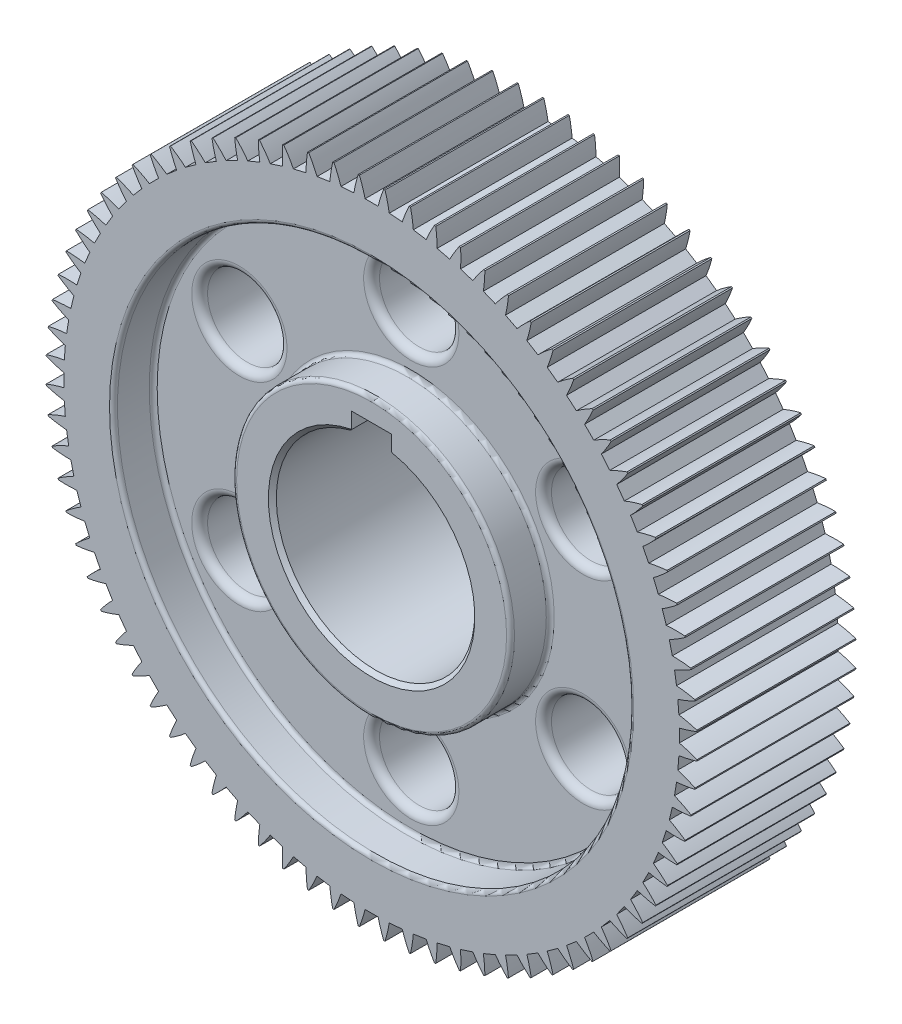
from build123d import *

# Parameters (mm, degrees)
SKETCH1_R           = 82
BOSS_EXTRUDE1_DEPTH = 40
CUT_EXTRUDE1_DEPTH  = 123.670289802
CIRPATTERN1_COUNT   = 80
CUT_EXTRUDE2_DEPTH  = 123.593963799
SKETCH5_R           = 65
SKETCH5_R_2         = 35
CUT_EXTRUDE3_DEPTH  = 10
CUT_EXTRUDE5_START  = -30
SKETCH5_3_R         = 65
SKETCH5_3_R_2       = 35
CUT_EXTRUDE5_DEPTH  = 10
SKETCH6_R           = 10
CUT_EXTRUDE6_DEPTH  = 120.704970489
CIRPATTERN2_COUNT   = 6
CHAMFER1_SIZE       = 1.282386845
CHAMFER1_SIZE_2     = 1
FILLET1_R           = 1
FILLET2_R           = 1
FILLET3_R           = 2


with BuildPart() as part:
    # Sketch1 → Boss-Extrude1 (new body)
    with BuildSketch(Plane.XY):
        Circle(SKETCH1_R)
    extrude(amount=BOSS_EXTRUDE1_DEPTH)

    # Sketch3 → Cut-Extrude1 (cut, through all)
    with BuildSketch(Plane.XY.offset(40)):
        with BuildLine():
            Line((3.082235405, 82), (-3.082235405, 82))
            ThreePointArc((-3.082235405, 82), (-2.280035939, 79.775379357), (-1.63574581, 77.5))
            Line((-1.63574581, 77.5), (1.63574581, 77.5))
            ThreePointArc((1.63574581, 77.5), (2.280035939, 79.775379357), (3.082235405, 82))
        make_face()
    cut_extrude1 = extrude(amount=-CUT_EXTRUDE1_DEPTH, mode=Mode.SUBTRACT)

    # CirPattern1: Cut-Extrude1 ×80 about axis
    cirpattern1_axis = Axis((0, 0, 0), (0, 0, 1))
    for i in range(1, CIRPATTERN1_COUNT):
        add(cut_extrude1.rotate(cirpattern1_axis, i * 360 / CIRPATTERN1_COUNT), mode=Mode.SUBTRACT)

    # Sketch4 → Cut-Extrude2 (cut, through all)
    with BuildSketch(Plane.XY.offset(40)):
        with BuildLine():
            Line((-5, 24.494897428), (-5, 29.494897428))
            Line((-5, 29.494897428), (5, 29.494897428))
            Line((5, 29.494897428), (5, 24.494897428))
            ThreePointArc((5, 24.494897428), (0, -25), (-5, 24.494897428))
        make_face()
    extrude(amount=-CUT_EXTRUDE2_DEPTH, mode=Mode.SUBTRACT)

    # Sketch5 → Cut-Extrude3 (cut)
    with BuildSketch(Plane.XY.offset(40)):
        Circle(SKETCH5_R)
        Circle(SKETCH5_R_2, mode=Mode.SUBTRACT)
    extrude(amount=-CUT_EXTRUDE3_DEPTH, mode=Mode.SUBTRACT)

    # Sketch5<3> → Cut-Extrude5 (cut)
    with BuildSketch(Plane.XY.offset(40).offset(CUT_EXTRUDE5_START)):
        Circle(SKETCH5_3_R)
        Circle(SKETCH5_3_R_2, mode=Mode.SUBTRACT)
    extrude(amount=-CUT_EXTRUDE5_DEPTH, mode=Mode.SUBTRACT)

    # Sketch6 → Cut-Extrude6 (cut, through all)
    with BuildSketch(Plane.XY.offset(30)):
        with Locations((0, 50)):
            Circle(SKETCH6_R)
    cut_extrude6 = extrude(amount=-CUT_EXTRUDE6_DEPTH, mode=Mode.SUBTRACT)

    # CirPattern2: Cut-Extrude6 ×6 about axis
    cirpattern2_axis = Axis((0, 0, 0), (0, 0, 1))
    for i in range(1, CIRPATTERN2_COUNT):
        add(cut_extrude6.rotate(cirpattern2_axis, i * 360 / CIRPATTERN2_COUNT), mode=Mode.SUBTRACT)

    # Chamfer1
    # the kernel refuses this chamfer: 1.282386845, 1 mm, written as the material it takes off along each edge
    with BuildSketch(Plane(origin=(5, 24.494897428, 43.313703696), x_dir=(0.9755073166514414, -0.21996698652185087, 0), z_dir=(0, 0, -1))) as chamfer1_piece_1:
        with BuildLine():
            Line((1.021064378, 0), (-CHAMFER1_SIZE * 0.219966986468, -CHAMFER1_SIZE * 0.975507316414))
            Line((-CHAMFER1_SIZE * 0.219966986468, -CHAMFER1_SIZE * 0.975507316414), (0, 0))
            ThreePointArc((0, 0), (0.529051464, -0.005206547), (1.021064378, 0))
        make_face()
    extrude(amount=46.627407392, mode=Mode.SUBTRACT)
    with BuildSketch(Plane(origin=(-5, 24.494897428, 43.451878786), x_dir=(-0.9740977649700819, -0.2261272745165674, 0), z_dir=(0, 0, -1))) as chamfer1_piece_2:
        with BuildLine():
            Line((1.33695114, 0), (-CHAMFER1_SIZE_2 * 0.226127274517, CHAMFER1_SIZE_2 * 0.97409776497))
            Line((-CHAMFER1_SIZE_2 * 0.226127274517, CHAMFER1_SIZE_2 * 0.97409776497), (0, 0))
            ThreePointArc((0, 0), (0.690262081, 0.008929297), (1.33695114, 0))
        make_face()
    extrude(amount=46.903757573, mode=Mode.SUBTRACT)
    # the kernel refuses this chamfer: 1.282386845, 1 mm, written as the material it takes off along each edge
    with BuildSketch(Plane(origin=(0, 0, 0), x_dir=(-0.15083446325007357, 0.988559034502271, 0), z_dir=(0.988559034502271, 0.15083446325007357, 0))) as chamfer1_2_piece_1:
        Polygon((25 + CHAMFER1_SIZE_2, 0), (25, CHAMFER1_SIZE_2), (25, 0), align=None)
    revolve(axis=Axis((0, 0, 0), (0, 0, 1)), revolution_arc=343.373585671, mode=Mode.SUBTRACT)
    with BuildSketch(Plane(origin=(0, 0, 40), x_dir=(0.13832834518394807, 0.9903864240379461, 0), z_dir=(-0.9903864240379461, 0.13832834518394807, 0))) as chamfer1_2_piece_2:
        Polygon((25 + CHAMFER1_SIZE_2, 0), (25, CHAMFER1_SIZE_2), (25, 0), align=None)
    revolve(axis=Axis((0, 0, 40), (0, 0, -1)), revolution_arc=343.373585671, mode=Mode.SUBTRACT)

    # Fillet1
    fillet1_edges = [part.edges().sort_by_distance(p)[0] for p in [
        (-35, 0, 30),
        (-35, 0, 40),
        (-35, 0, 0),
        (-35, 0, 10),
    ]]
    fillet(fillet1_edges, radius=FILLET1_R)

    # Fillet2
    fillet2_edges = [part.edges().sort_by_distance(p)[0] for p in [
        (-65, 0, 30),
        (-65, 0, 40),
        (-65, 0, 0),
        (-65, 0, 10),
    ]]
    fillet(fillet2_edges, radius=FILLET2_R)

    # Fillet3
    fillet3_edges = [part.edges().sort_by_distance(p)[0] for p in [
        (-10, 50, 10),
        (-10, 50, 30),
        (38.301270189, 33.660254038, 10),
        (38.301270189, 33.660254038, 30),
        (48.301270189, -16.339745962, 10),
        (48.301270189, -16.339745962, 30),
        (10, -50, 10),
        (10, -50, 30),
        (-38.301270189, -33.660254038, 10),
        (-38.301270189, -33.660254038, 30),
        (-48.301270189, 16.339745962, 10),
        (-48.301270189, 16.339745962, 30),
    ]]
    fillet(fillet3_edges, radius=FILLET3_R)


solid = part.part
